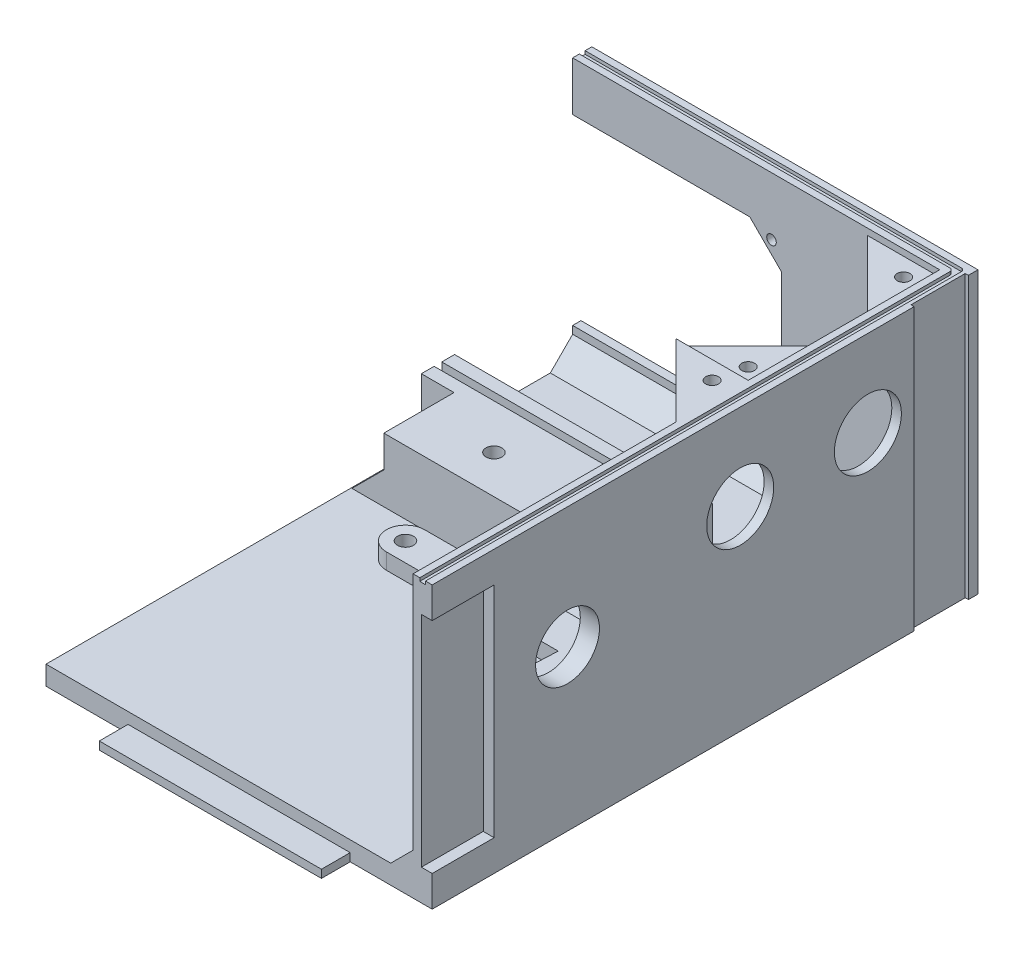
from build123d import *

# Parameters (mm, degrees)
SKETCH2_W               = 121
SKETCH2_H               = 171
BOSS_EXTRUDE1_DEPTH     = 88
SKETCH4_W               = 115
SKETCH4_H               = 165
CUT_EXTRUDE1_DEPTH      = 82
SKETCH5_W               = 41
SKETCH5_H               = 121.6
CUT_EXTRUDE2_DEPTH      = 3.2
SKETCH6_W               = 69.6
SKETCH6_H               = 9
BOSS_EXTRUDE2_DEPTH     = 2.5
SKETCH7_W               = 19.4
SKETCH7_H               = 68.6
CUT_EXTRUDE3_DEPTH      = 3.4
SKETCH9_W               = 70.2
SKETCH9_H               = 66.6
CUT_EXTRUDE4_DEPTH      = 3.4
SKETCH10_W              = 65.5
SKETCH10_H              = 57.2
CUT_EXTRUDE5_DEPTH      = 2.6
SKETCH11_R              = 10.5
SKETCH11_R_2            = 10
CUT_EXTRUDE6_DEPTH      = 228.213555934
BOSS_EXTRUDE4_DEPTH     = 7.5
BOSS_EXTRUDE5_DEPTH     = 9
CUT_EXTRUDE10_DEPTH     = 2
BOSS_EXTRUDE6_DEPTH     = 72.5
SKETCH18_R              = 2
CUT_EXTRUDE11_DEPTH     = 5
SKETCH19_R              = 2
CUT_EXTRUDE12_DEPTH     = 5
SKETCH20_R              = 4.75
BOSS_EXTRUDE7_DEPTH     = 5
SKETCH21_R              = 2
CUT_EXTRUDE13_DEPTH     = 5
SKETCH22_R              = 2.5
CUT_EXTRUDE14_DEPTH     = 6
BOSS_EXTRUDE17_REACH    = 229.214
BOSS_EXTRUDE18_REACH    = 229.214
BOSS_EXTRUDE19_DEPTH    = 5
BOSS_EXTRUDE20_DEPTH    = 20
BOSS_EXTRUDE22_DEPTH    = 20
CHAMFER1_SIZE           = 10
CHAMFER2_SIZE           = 10
SKETCH38_R              = 2.5
CUT_EXTRUDE15_DEPTH     = 5
CHAMFER3_SIZE           = 5
CUT_EXTRUDE16_START     = -3
CUT_EXTRUDE16_OUTLINE_R = 10.5
CUT_EXTRUDE16_DEPTH     = 3
CUT_EXTRUDE17_DEPTH     = 1
SKETCH42_W              = 17
SKETCH42_H              = 88
CUT_EXTRUDE18_DEPTH     = 1
SKETCH44_W              = 77.75
SKETCH44_H              = 20
BOSS_EXTRUDE25_DEPTH    = 1
BOSS_EXTRUDE26_DEPTH    = 2.6
SKETCH46_R              = 1.5
CUT_EXTRUDE19_DEPTH     = 2.6
FILLET1_R               = 1
SKETCH48_W              = 25
SKETCH48_H              = 20
CUT_EXTRUDE21_DEPTH     = 10
BOSS_EXTRUDE27_DEPTH    = 2
SKETCH50_R              = 2
CUT_EXTRUDE22_DEPTH     = 5


# Read off the part's stored shape, not the designer's step: Cut-Extrude16
with BuildPart() as part:
    # Sketch2 → Boss-Extrude1 (new body)
    with BuildSketch(Plane(origin=(0, 0, 0), x_dir=(1, 0, 0), z_dir=(0, 1, 0))):
        with Locations((60.5, 85.5)):
            Rectangle(SKETCH2_W, SKETCH2_H)
    extrude(amount=BOSS_EXTRUDE1_DEPTH)

    # Sketch4 → Cut-Extrude1 (cut)
    with BuildSketch(Plane(origin=(0, 88, 0), x_dir=(1, 0, 0), z_dir=(0, 1, 0))):
        with Locations((57.5, 82.5)):
            Rectangle(SKETCH4_W, SKETCH4_H)
    extrude(amount=-CUT_EXTRUDE1_DEPTH, mode=Mode.SUBTRACT)

    # Sketch5 → Cut-Extrude2 (cut)
    with BuildSketch(Plane.XZ):
        with Locations((20.5, -85.5)):
            Rectangle(SKETCH5_W, SKETCH5_H)
    extrude(amount=-CUT_EXTRUDE2_DEPTH, mode=Mode.SUBTRACT)

    # Sketch6 → Boss-Extrude2 (add)
    with BuildSketch(Plane.XZ):
        with Locations((60.5, 4.5)):
            Rectangle(SKETCH6_W, SKETCH6_H)
    extrude(amount=-BOSS_EXTRUDE2_DEPTH)

    # Sketch7 → Cut-Extrude3 (cut)
    with BuildSketch(Plane(origin=(121, 0, 0), x_dir=(0, 0, -1), z_dir=(1, 0, 0))):
        with Locations((9.7, 44)):
            Rectangle(SKETCH7_W, SKETCH7_H)
    extrude(amount=-CUT_EXTRUDE3_DEPTH, mode=Mode.SUBTRACT)

    # Sketch9 → Cut-Extrude4 (cut)
    with BuildSketch(Plane(origin=(0, 0, -171), x_dir=(-1, 0, 0), z_dir=(0, 0, -1))):
        with Locations((-35.1, 44)):
            Rectangle(SKETCH9_W, SKETCH9_H)
    extrude(amount=-CUT_EXTRUDE4_DEPTH, mode=Mode.SUBTRACT)

    # Sketch10 → Cut-Extrude5 (cut)
    with BuildSketch(Plane(origin=(0, 0, -167.6), x_dir=(-1, 0, 0), z_dir=(0, 0, -1))):
        with Locations((-32.75, 44)):
            Rectangle(SKETCH10_W, SKETCH10_H)
    extrude(amount=-CUT_EXTRUDE5_DEPTH, mode=Mode.SUBTRACT)

    # Sketch11 → Cut-Extrude6 (cut, through all)
    with BuildSketch(Plane(origin=(121, 0, 0), x_dir=(0, 0, -1), z_dir=(1, 0, 0))):
        with Locations((136.5, 61)):
            Circle(SKETCH11_R)
        with Locations((96.5, 61)):
            Circle(SKETCH11_R)
        with Locations((42.4, 50)):
            Circle(SKETCH11_R_2)
    extrude(amount=-CUT_EXTRUDE6_DEPTH, mode=Mode.SUBTRACT)

    # Sketch14 → Boss-Extrude4 (add)
    with BuildSketch(Plane(origin=(0, 86, 0), x_dir=(1, 0, 0), z_dir=(0, 1, 0))):
        Polygon((115, 142.372583002), (115, 165), (92.372583002, 165), align=None)
    extrude(amount=-BOSS_EXTRUDE4_DEPTH)

    # Sketch15 → Boss-Extrude5 (add)
    with BuildSketch(Plane(origin=(0, 88, 0), x_dir=(1, 0, 0), z_dir=(0, 1, 0))):
        Polygon((115, 105), (115, 82.372583002), (92.372583002, 105), (115, 127.627416998), align=None)
    extrude(amount=-BOSS_EXTRUDE5_DEPTH)

    # Sketch16 → Cut-Extrude10 (cut)
    with BuildSketch(Plane(origin=(0, 88, 0), x_dir=(1, 0, 0), z_dir=(0, 1, 0))):
        Polygon((115, 127.627416998), (115, 105), (92.372583002, 105), align=None)
    extrude(amount=-CUT_EXTRUDE10_DEPTH, mode=Mode.SUBTRACT)

    # Sketch17 → Boss-Extrude6 (add)
    with BuildSketch(Plane(origin=(0, 6, 0), x_dir=(1, 0, 0), z_dir=(0, 1, 0))):
        Polygon((115, 165), (108, 165), (115, 158), align=None)
    extrude(amount=BOSS_EXTRUDE6_DEPTH)

    # Sketch18 → Cut-Extrude11 (cut)
    with BuildSketch(Plane(origin=(0, 86, 0), x_dir=(1, 0, 0), z_dir=(0, 1, 0))):
        with Locations(Location((109.343145751, 159.343145751, 0), (0, 0, 270))):
            Circle(SKETCH18_R)
        with Locations(Location((109.343145751, 110.656854249, 0), (0, 0, 270))):
            Circle(SKETCH18_R)
    extrude(amount=-CUT_EXTRUDE11_DEPTH, mode=Mode.SUBTRACT)

    # Sketch19 → Cut-Extrude12 (cut)
    with BuildSketch(Plane(origin=(0, 88, 0), x_dir=(1, 0, 0), z_dir=(0, 1, 0))):
        with Locations(Location((109.343145751, 99.343145751, 0), (0, 0, 270))):
            Circle(SKETCH19_R)
    extrude(amount=-CUT_EXTRUDE12_DEPTH, mode=Mode.SUBTRACT)

    # Sketch20 → Boss-Extrude7 (add)
    with BuildSketch(Plane(origin=(0, 6, 0), x_dir=(1, 0, 0), z_dir=(0, 1, 0))):
        with Locations(Location((85, 47.7, 0), (0, 0, 90))):
            Circle(SKETCH20_R)
        with BuildLine():
            Line((27.85, 78.78), (88, 78.78))
            ThreePointArc((88, 78.78), (94, 84.78), (88, 90.78))
            Line((88, 90.78), (27.85, 90.78))
            ThreePointArc((27.85, 90.78), (21.85, 84.78), (27.85, 78.78))
        make_face()
    extrude(amount=BOSS_EXTRUDE7_DEPTH)

    # Sketch21 → Cut-Extrude13 (cut)
    with BuildSketch(Plane(origin=(0, 11, 0), x_dir=(1, 0, 0), z_dir=(0, 1, 0))):
        with Locations(Location((85, 47.7, 0), (0, 0, 270))):
            Circle(SKETCH21_R)
    extrude(amount=-CUT_EXTRUDE13_DEPTH, mode=Mode.SUBTRACT)

    # Sketch22 → Cut-Extrude14 (cut)
    with BuildSketch(Plane(origin=(0, 11, 0), x_dir=(1, 0, 0), z_dir=(0, 1, 0))):
        with Locations(Location((88, 84.78, 0), (0, 0, 270))):
            Circle(SKETCH22_R)
        with Locations(Location((27.85, 84.78, 0), (0, 0, 270))):
            Circle(SKETCH22_R)
    extrude(amount=-CUT_EXTRUDE14_DEPTH, mode=Mode.SUBTRACT)

    # Boss-Extrude17: up to this plane
    boss_extrude17_end = Plane(origin=(108, 88.399494937, -165), z_dir=(0.7071067811865476, 0, -0.7071067811865476))
    # Sketch33 → Boss-Extrude17 (add, up to the surface)
    with BuildSketch(Plane.XY, mode=Mode.PRIVATE) as boss_extrude17_sk1:
        Polygon((108, 6), (115, 13), (115, 6), align=None)
    boss_extrude17_tool1 = split(extrude(boss_extrude17_sk1.sketch, amount=-BOSS_EXTRUDE17_REACH, mode=Mode.PRIVATE), bisect_by=boss_extrude17_end, keep=Keep.BOTH, mode=Mode.PRIVATE)
    add(boss_extrude17_tool1.solids().sort_by_distance((112.666667, 8.333333, 0))[0])

    # Boss-Extrude18: up to this plane
    boss_extrude18_end = Plane(origin=(108, 88.399494937, -165), z_dir=(0.7071067811865476, 0, -0.7071067811865476))
    # Sketch34 → Boss-Extrude18 (add, up to the surface)
    with BuildSketch(Plane.ZY, mode=Mode.PRIVATE) as boss_extrude18_sk1:
        Polygon((-165, 6), (-165, 13), (-158, 6), align=None)
    boss_extrude18_tool1 = split(extrude(boss_extrude18_sk1.sketch, amount=-BOSS_EXTRUDE18_REACH, mode=Mode.PRIVATE), bisect_by=boss_extrude18_end, keep=Keep.BOTH, mode=Mode.PRIVATE)
    add(boss_extrude18_tool1.solids().sort_by_distance((0, 8.333333, -162.666667))[0])

    # Sketch35 → Boss-Extrude19 (add)
    with BuildSketch(Plane(origin=(0, 6, 0), x_dir=(1, 0, 0), z_dir=(0, 1, 0))):
        with BuildLine():
            Line((82.006660465, 85.062632648), (80.255272868, 47.923750847))
            ThreePointArc((80.255272868, 47.923750847), (85.383052558, 52.434529622), (89.718985156, 47.158078331))
            Line((89.718985156, 47.158078331), (93.960823355, 84.095467366))
            ThreePointArc((93.960823355, 84.095467366), (87.516144137, 78.799541531), (82.006660465, 85.062632648))
        make_face()
    extrude(amount=BOSS_EXTRUDE19_DEPTH)

    # Sketch36 → Boss-Extrude20 (add)
    with BuildSketch(Plane(origin=(0, 6, 0), x_dir=(1, 0, 0), z_dir=(0, 1, 0))):
        Polygon((80.75, 128), (0, 128), (0, 125), (77.75, 125), (77.75, 121.6), (0, 121.6), (0, 117.6), (80.75, 117.6), align=None)
    extrude(amount=BOSS_EXTRUDE20_DEPTH)

    # Sketch37 → Boss-Extrude22 (add)
    with BuildSketch(Plane.XY.offset(-117.6)):
        Polygon((55.24, 26), (10.24, 26), (10.24, 6), (20.24, 6), (20.24, 21), (45.24, 21), (45.24, 6), (55.24, 6), align=None)
    extrude(amount=BOSS_EXTRUDE22_DEPTH)

    # Chamfer1
    chamfer1_edges = [part.edges().sort_by_distance(p)[0] for p in [
        (10.24, 6, -107.6),
    ]]
    chamfer(chamfer1_edges, length=CHAMFER1_SIZE)

    # Chamfer2
    chamfer2_edges = [part.edges().sort_by_distance(p)[0] for p in [
        (55.24, 6, -107.6),
    ]]
    chamfer(chamfer2_edges, length=CHAMFER2_SIZE)

    # Sketch38 → Cut-Extrude15 (cut)
    with BuildSketch(Plane(origin=(0, 26, 0), x_dir=(1, 0, 0), z_dir=(0, 1, 0))):
        with Locations(Location((32.74, 107.6, 0), (0, 0, 270))):
            Circle(SKETCH38_R)
    extrude(amount=-CUT_EXTRUDE15_DEPTH, mode=Mode.SUBTRACT)

    # Chamfer3
    chamfer3_edges = [part.edges().sort_by_distance(p)[0] for p in [
        (40.375, 6, -128),
    ]]
    chamfer(chamfer3_edges, length=CHAMFER3_SIZE)

    # Cut-Extrude16 outline → Cut-Extrude16 (cut)
    with BuildSketch(Plane.ZY.offset(-115).offset(CUT_EXTRUDE16_START)):
        with BuildLine():
            Line((-96.5, 78.5), (-136.5, 78.5))
            ThreePointArc((-136.5, 78.5), (-154, 61), (-136.5, 43.5))
            Line((-136.5, 43.5), (-96.5, 43.5))
            ThreePointArc((-96.5, 43.5), (-79, 61), (-96.5, 78.5))
        make_face()
        with Locations((-136.5, 61)):
            Circle(CUT_EXTRUDE16_OUTLINE_R, mode=Mode.SUBTRACT)
        with Locations((-96.5, 61)):
            Circle(CUT_EXTRUDE16_OUTLINE_R, mode=Mode.SUBTRACT)
    extrude(amount=CUT_EXTRUDE16_DEPTH, mode=Mode.SUBTRACT)

    # Sketch40 → Cut-Extrude17 (cut)
    with BuildSketch(Plane(origin=(0, 88, 0), x_dir=(1, 0, 0), z_dir=(0, 1, 0))):
        Polygon((117.1, 0), (118.9, 0), (118.9, 168.9), (0, 168.9), (0, 167.1), (117.1, 167.1), align=None)
    extrude(amount=-CUT_EXTRUDE17_DEPTH, mode=Mode.SUBTRACT)

    # Sketch42 → Cut-Extrude18 (cut)
    with BuildSketch(Plane(origin=(121, 0, 0), x_dir=(0, 0, -1), z_dir=(1, 0, 0))):
        with Locations((159.5, 44)):
            Rectangle(SKETCH42_W, SKETCH42_H)
    extrude(amount=-CUT_EXTRUDE18_DEPTH, mode=Mode.SUBTRACT)

    # Sketch44 → Boss-Extrude25 (add)
    with BuildSketch(Plane.XY.offset(-125)):
        with Locations((38.875, 16)):
            Rectangle(SKETCH44_W, SKETCH44_H)
    extrude(amount=BOSS_EXTRUDE25_DEPTH)

    # Sketch45 → Boss-Extrude26 (add)
    with BuildSketch(Plane(origin=(0, 0, -167.6), x_dir=(-1, 0, 0), z_dir=(0, 0, -1))):
        Polygon((-65.5, 72.6), (-65.5, 62.6), (-55.5, 72.6), align=None)
        Polygon((-65.5, 15.4), (-65.5, 25.4), (-55.5, 15.4), align=None)
    extrude(amount=-BOSS_EXTRUDE26_DEPTH)

    # Sketch46 → Cut-Extrude19 (cut)
    with BuildSketch(Plane(origin=(0, 0, -167.6), x_dir=(-1, 0, 0), z_dir=(0, 0, -1))):
        with Locations((-62.3, 18.6)):
            Circle(SKETCH46_R)
        with Locations((-62.3, 69.8)):
            Circle(SKETCH46_R)
    extrude(amount=-CUT_EXTRUDE19_DEPTH, mode=Mode.SUBTRACT)

    # Fillet1
    fillet1_edges = [part.edges().sort_by_distance(p)[0] for p in [
        (117.1, 87.5, -167.1),
        (118.9, 87.5, -168.9),
    ]]
    fillet(fillet1_edges, radius=FILLET1_R)

    # Sketch48 → Cut-Extrude21 (cut)
    with BuildSketch(Plane(origin=(0, 6, 0), x_dir=(1, 0, 0), z_dir=(0, 1, 0))):
        with Locations((32.74, 107.6)):
            Rectangle(SKETCH48_W, SKETCH48_H)
    extrude(amount=-CUT_EXTRUDE21_DEPTH, mode=Mode.SUBTRACT)

    # Sketch49 → Boss-Extrude27 (add)
    with BuildSketch(Plane.XY.offset(-97.6)):
        Polygon((10.24, 16), (0.24, 6), (20.24, 6), (45.24, 6), (65.24, 6), (55.24, 16), (55.24, 26), (10.24, 26), align=None)
    extrude(amount=BOSS_EXTRUDE27_DEPTH)

    # Sketch50 → Cut-Extrude22 (cut)
    with BuildSketch(Plane.XZ):
        with Locations(Location((105, -159.5, 0), (0, 0, 270))):
            Circle(SKETCH50_R)
    extrude(amount=-CUT_EXTRUDE22_DEPTH, mode=Mode.SUBTRACT)


solid = part.part
